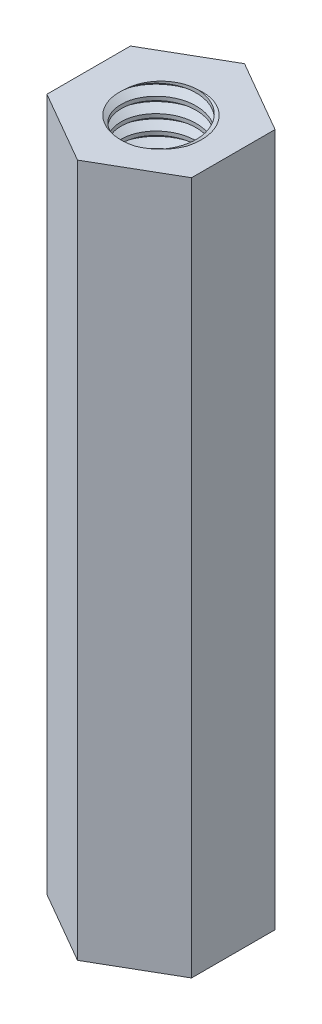
from build123d import *

# Parameters (mm, degrees)
SKETCH1_R           = 1.25
BOSS_EXTRUDE1_DEPTH = 11.5
THREAD1_PITCH       = 0.5
BOSS_EXTRUDE2_DEPTH = 6


with BuildPart() as part:
    # Sketch1 → Boss-Extrude1 (new, symmetric)
    with BuildSketch(Plane(origin=(0, 0, 0), x_dir=(1, 0, 0), z_dir=(0, 1, 0))):
        Polygon((2.4, 1.385640646), (0, 2.771281292), (-2.4, 1.385640646), (-2.4, -1.385640646), (0, -2.771281292), (2.4, -1.385640646), align=None)
        with Locations(Location((0, 0, 0), (0, 0, 270))):
            Circle(SKETCH1_R, mode=Mode.SUBTRACT)
    extrude(amount=BOSS_EXTRUDE1_DEPTH, both=True)

    # Thread1: arcs per turn and ends read off the stored shape
    # Thread1: the profile of Thread Profile1 profile screwed along a right-hand helix through 64 turns, 6 arcs to a turn; built about Z, then put on its axis
    thread1_z = Axis((0, 0, 0), (0, 0, 1))
    thread1_corners = [(1.2497, 0, -0.000173205), (1.520632938, 0, 0.156249999), (1.520632937, 0, 0.218749999), (1.2497, 0, 0.375173204)]
    with BuildLine(mode=Mode.PRIVATE) as thread1_profile:
        Line(thread1_corners[0], thread1_corners[1])
        Line(thread1_corners[1], thread1_corners[2])
        Line(thread1_corners[2], thread1_corners[3])
        Line(thread1_corners[3], thread1_corners[0])
    thread1_cap = Face(thread1_profile.wire())
    thread1_turn_angles = [0, 30, 60, 90, 120, 150, 180, 210, 240, 270, 300, 330, 360]
    thread1_turn_weights = [1, 0.8660254037844387, 1, 0.8660254037844387, 1, 0.8660254037844387, 1, 0.8660254037844387, 1, 0.8660254037844387, 1, 0.8660254037844387, 1]
    thread1_turn_rails = [Edge.make_bspline([Vector(p[0], p[1], 0).rotate(thread1_z, thread1_turn_angles[k]) / thread1_turn_weights[k] + Vector(0, 0, p[2] + THREAD1_PITCH * thread1_turn_angles[k] / 360) for k in range(13)], [0, 0, 0, 1, 1, 2, 2, 3, 3, 4, 4, 5, 5, 6, 6, 6], 2, thread1_turn_weights) for p in thread1_corners]
    thread1_turn_sides = [Face.make_surface_from_curves(thread1_turn_rails[p[0]], thread1_turn_rails[p[1]]) for p in [(0, 1), (1, 2), (2, 3), (3, 0)]]
    thread1 = Plane(origin=(0, 13.5, 0), x_dir=(-1, 0, 0), z_dir=(0, -1, 0)) * Solid(Shell([*[p.moved(Location((0, 0, THREAD1_PITCH * i))) for i in range(64) for p in thread1_turn_sides], thread1_cap, thread1_cap.rotate(thread1_z, 23040).moved(Location((0, 0, THREAD1_PITCH * 23040 / 360)))]))
    add(thread1, mode=Mode.SUBTRACT)

    # Sketch2 → Boss-Extrude2 (add, symmetric)
    with BuildSketch(Plane(origin=(0, 0, 0), x_dir=(1, 0, 0), z_dir=(0, 1, 0))):
        Polygon((2.4, -1.385640646), (2.4, 1.385640646), (0, 2.771281292), (-2.4, 1.385640646), (-2.4, -1.385640646), (0, -2.771281292), align=None)
    extrude(amount=BOSS_EXTRUDE2_DEPTH, both=True)


solid = part.part
